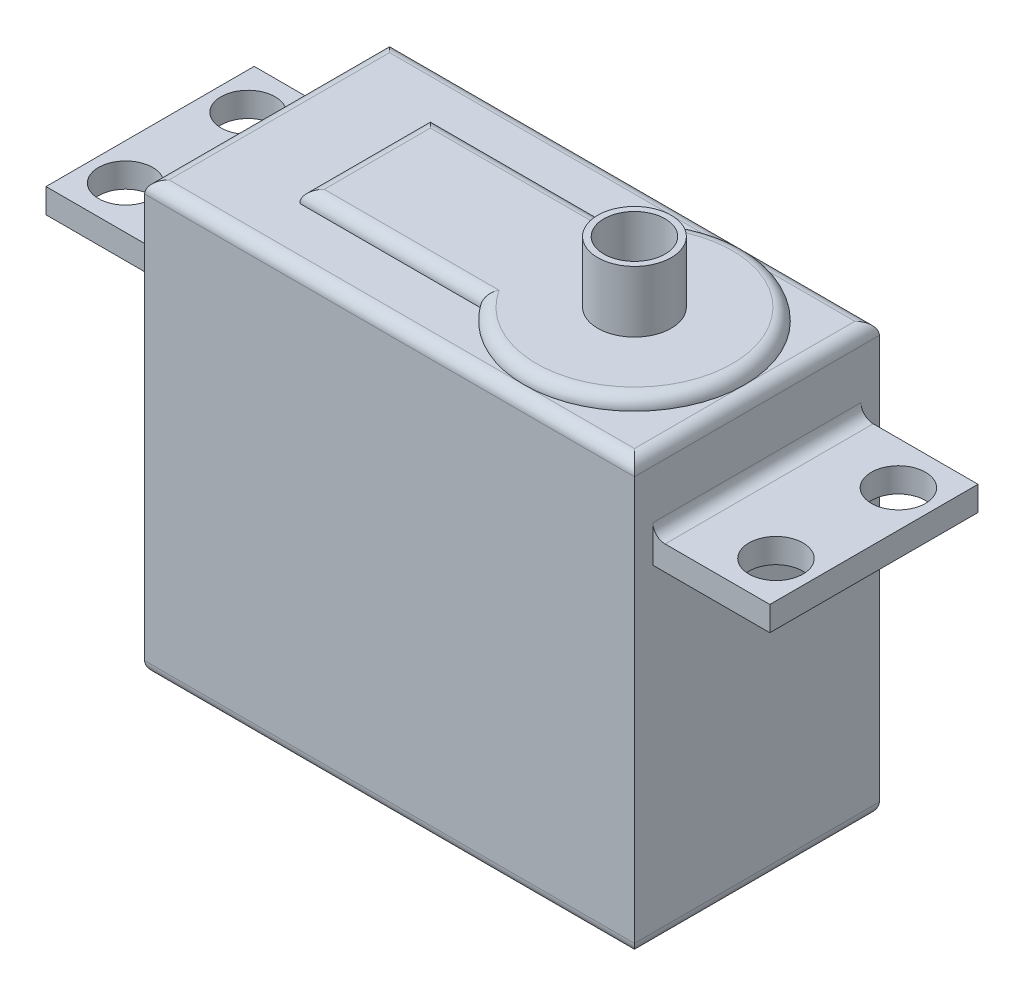
from build123d import *

# Parameters (mm, degrees)
SKETCH1_W           = 40
SKETCH1_H           = 35
BOSS_EXTRUDE1_DEPTH = 20
FILLET1_R           = 1
SKETCH2_W           = 9.556150209
SKETCH2_H           = 17
SKETCH2_R           = 2.209517665
BOSS_EXTRUDE2_DEPTH = 2
BOSS_EXTRUDE3_DEPTH = 1
SKETCH4_R           = 3
SKETCH4_R_2         = 2.5
BOSS_EXTRUDE4_DEPTH = 5
FILLET2_R           = 1


with BuildPart() as part:
    # Sketch1 → Boss-Extrude1 (new body)
    with BuildSketch(Plane.XY):
        Rectangle(SKETCH1_W, SKETCH1_H)
    extrude(amount=BOSS_EXTRUDE1_DEPTH)

    # Fillet1
    fillet1_edges = [part.edges().sort_by_distance(p)[0] for p in [
        (0, -17.5, 20),
        (0, -17.5, 0),
        (0, 17.5, 0),
        (20, -17.5, 10),
        (-20, -17.5, 10),
        (-20, 17.5, 10),
        (20, 17.5, 10),
        (0, 17.5, 20),
    ]]
    fillet(fillet1_edges, radius=FILLET1_R)

    # Sketch2 → Boss-Extrude2 (add)
    # profile 1 of 2: a face of its own
    with BuildSketch(Plane(origin=(0, 9.5, 0), x_dir=(-1, 0, 0), z_dir=(0, 1, 0))):
        with Locations((24.778075105, 10)):
            Rectangle(SKETCH2_W, SKETCH2_H)
        with Locations(Location((26.556150209, 5, 0), (0, 0, 270))):
            Circle(SKETCH2_R, mode=Mode.SUBTRACT)
        with Locations(Location((26.556150209, 15, 0), (0, 0, 90))):
            Circle(SKETCH2_R, mode=Mode.SUBTRACT)
    # profile 2 of 2: a face of its own
    with BuildSketch(Plane(origin=(0, 9.5, 0), x_dir=(-1, 0, 0), z_dir=(0, 1, 0))):
        with Locations((-24.778075105, 10)):
            Rectangle(SKETCH2_W, SKETCH2_H)
        with Locations(Location((-26.556150209, 5, 0), (0, 0, 90))):
            Circle(SKETCH2_R, mode=Mode.SUBTRACT)
        with Locations(Location((-26.556150209, 15, 0), (0, 0, 270))):
            Circle(SKETCH2_R, mode=Mode.SUBTRACT)
    extrude(amount=BOSS_EXTRUDE2_DEPTH)

    # Sketch3 → Boss-Extrude3 (add)
    with BuildSketch(Plane(origin=(0, 17.5, 0), x_dir=(1, 0, 0), z_dir=(0, 1, 0))):
        with BuildLine():
            Line((2.749933149, -4.667408636), (-12, -4.667408636))
            Line((-12, -4.667408636), (-12, -15.332591364))
            Line((-12, -15.332591364), (2.749933149, -15.332591364))
            ThreePointArc((2.749933149, -15.332591364), (19, -10), (2.749933149, -4.667408636))
        make_face()
    extrude(amount=BOSS_EXTRUDE3_DEPTH)

    # Sketch4 → Boss-Extrude4 (add)
    with BuildSketch(Plane(origin=(0, 18.5, 0), x_dir=(1, 0, 0), z_dir=(0, 1, 0))):
        with Locations(Location((10, -10, 0), (0, 0, 270))):
            Circle(SKETCH4_R)
        with Locations(Location((10, -10, 0), (0, 0, 270))):
            Circle(SKETCH4_R_2, mode=Mode.SUBTRACT)
    extrude(amount=BOSS_EXTRUDE4_DEPTH)

    # Fillet2
    fillet2_edges = [part.edges().sort_by_distance(p)[0] for p in [
        (20, 11.5, 10),
        (-20, 11.5, 10),
        (-12, 18.5, 10),
        (-4.625033426, 18.5, 4.667408636),
        (19, 18.5, 10),
        (-4.625033426, 18.5, 15.332591364),
    ]]
    fillet(fillet2_edges, radius=FILLET2_R - 0.0001)  # a hair under: the kernel refuses the full size


solid = part.part
